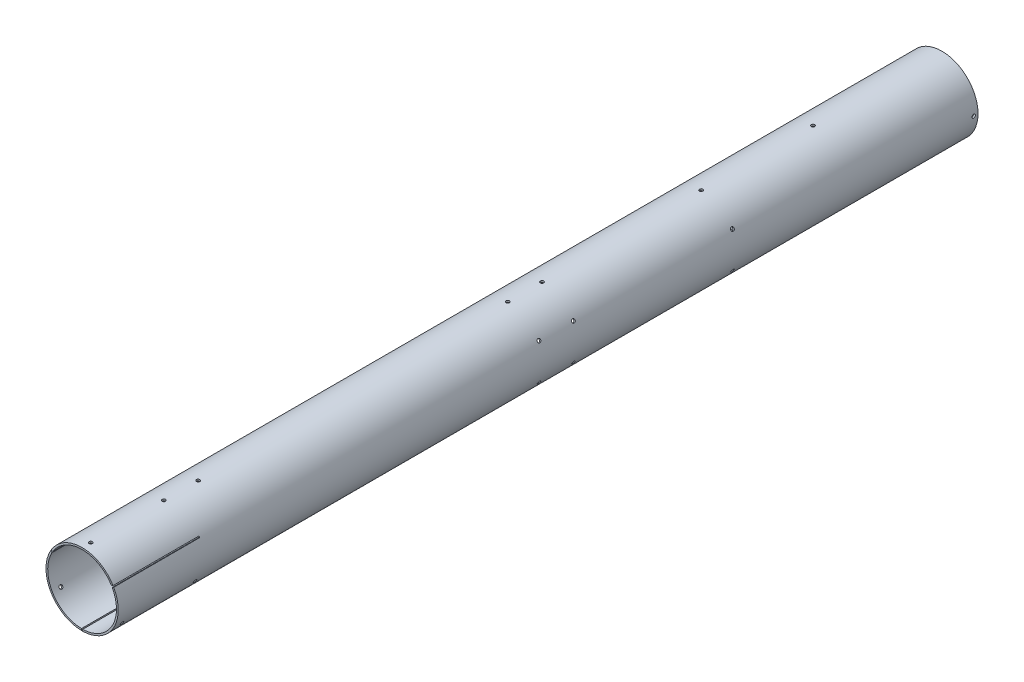
from build123d import *

# Parameters (mm, degrees)
SKETCH1_R               = 42
SKETCH1_R_2             = 40
BOSS_EXTRUDE1_DEPTH     = 1000
SKETCH2_W               = 1.5
SKETCH2_H               = 100
CUT_EXTRUDE1_DEPTH      = 1002.76244689
CIRPATTERN1_COUNT       = 3
SKETCH5_R               = 2
CUT_EXTRUDE3_DEPTH      = 1002.76244689
CIRPATTERN3_COUNT       = 3
SKETCH5_3_R             = 2
CUT_EXTRUDE4_DEPTH      = 1002.762447
CIRPATTERN4_COUNT       = 6
SKETCH5_5_R             = 2
CUT_EXTRUDE5_DEPTH      = 1002.762447
CUT_EXTRUDE6_DEPTH      = 1002.762447
CUT_EXTRUDE6_DEPTH_BACK = 1002.762447
SKETCH7_R               = 2
SKETCH6_W               = 55
SKETCH6_H               = 250
CUT_EXTRUDE7_DEPTH      = 1002.762447


with BuildPart() as part:
    # Sketch1 → Boss-Extrude1 (new body)
    with BuildSketch(Plane.XY):
        Circle(SKETCH1_R)
        Circle(SKETCH1_R_2, mode=Mode.SUBTRACT)
    extrude(amount=BOSS_EXTRUDE1_DEPTH)

    # Sketch2 → Cut-Extrude1 (cut, through all)
    with BuildSketch(Plane(origin=(0, 0, 0), x_dir=(1, 0, 0), z_dir=(0, 1, 0))):
        with Locations((0, -950)):
            Rectangle(SKETCH2_W, SKETCH2_H)
    cut_extrude1 = extrude(amount=-CUT_EXTRUDE1_DEPTH, mode=Mode.SUBTRACT)

    # CirPattern1: Cut-Extrude1 ×3 about axis
    cirpattern1_axis = Axis((0, 0, 525), (0, 0, -1))
    for i in range(1, CIRPATTERN1_COUNT):
        add(cut_extrude1.rotate(cirpattern1_axis, i * 360 / CIRPATTERN1_COUNT), mode=Mode.SUBTRACT)

    # Sketch5 → Cut-Extrude3 (cut, through all)
    with BuildSketch(Plane(origin=(0, 0, 0), x_dir=(1, 0, 0), z_dir=(0, 1, 0))):
        with Locations((0, -905)):
            Circle(SKETCH5_R)
        with Locations((0, -990)):
            Circle(SKETCH5_R)
    cut_extrude3 = extrude(amount=CUT_EXTRUDE3_DEPTH, mode=Mode.SUBTRACT)

    # CirPattern3: Cut-Extrude3 ×3 about axis
    cirpattern3_axis = Axis((0, 0, 525), (0, 0, -1))
    for i in range(1, CIRPATTERN3_COUNT):
        add(cut_extrude3.rotate(cirpattern3_axis, i * 360 / CIRPATTERN3_COUNT), mode=Mode.SUBTRACT)

    # Sketch5<3> → Cut-Extrude4 (cut, through all)
    with BuildSketch(Plane(origin=(0, 0, 0), x_dir=(1, 0, 0), z_dir=(0, 1, 0))):
        with Locations((0, -280)):
            Circle(SKETCH5_3_R)
        with Locations((0, -505)):
            Circle(SKETCH5_3_R)
        with Locations((0, -465)):
            Circle(SKETCH5_3_R)
    cut_extrude4 = extrude(amount=CUT_EXTRUDE4_DEPTH, mode=Mode.SUBTRACT)

    # CirPattern4: Cut-Extrude4 ×6 about axis
    cirpattern4_axis = Axis((0, 0, 525), (0, 0, -1))
    for i in range(1, CIRPATTERN4_COUNT):
        add(cut_extrude4.rotate(cirpattern4_axis, i * 360 / CIRPATTERN4_COUNT), mode=Mode.SUBTRACT)

    # Sketch5<5> → Cut-Extrude5 (cut, through all)
    with BuildSketch(Plane(origin=(0, 0, 0), x_dir=(1, 0, 0), z_dir=(0, 1, 0))):
        with Locations((0, -150)):
            Circle(SKETCH5_5_R)
        with Locations((0, -865)):
            Circle(SKETCH5_5_R)
    extrude(amount=CUT_EXTRUDE5_DEPTH, mode=Mode.SUBTRACT)

    # Sketch7 → Cut-Extrude6 (cut, two sides: drawn at the far end of the back side and taken through both)
    with BuildSketch(Plane(origin=(0, 0, 0), x_dir=(0, 0, -1), z_dir=(1, 0, 0)).offset(-CUT_EXTRUDE6_DEPTH_BACK)):
        with Locations((-5, 0)):
            Circle(SKETCH7_R)
    extrude(amount=CUT_EXTRUDE6_DEPTH + CUT_EXTRUDE6_DEPTH_BACK, mode=Mode.SUBTRACT)

    # Sketch6 → Cut-Extrude7 (cut, through all)
    with BuildSketch(Plane(origin=(0, 0, 0), x_dir=(1, 0, 0), z_dir=(0, 1, 0))):
        with Locations((0, -350)):
            Rectangle(SKETCH6_W, SKETCH6_H)
    extrude(amount=-CUT_EXTRUDE7_DEPTH, mode=Mode.SUBTRACT)


solid = part.part
